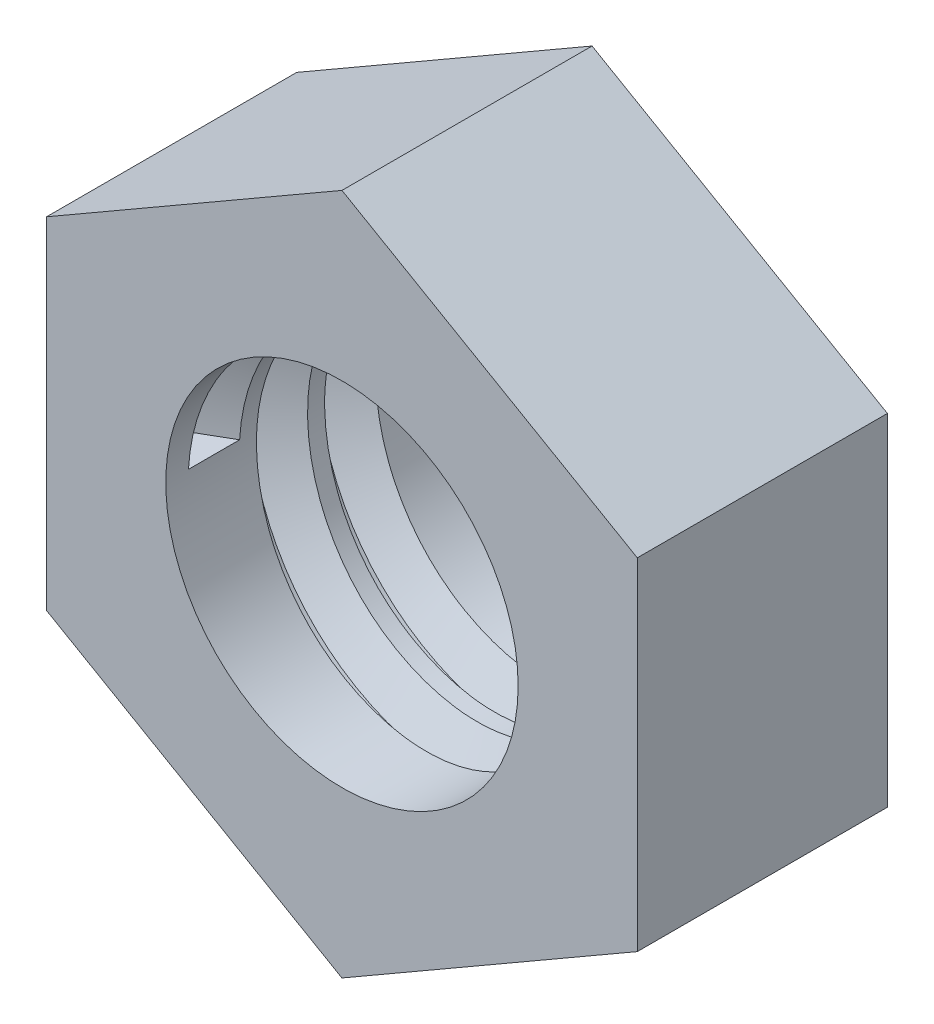
from build123d import *

# Parameters (mm, degrees)
SKETCH1_R           = 1.55
BOSS_EXTRUDE1_DEPTH = 2.2
THREAD1_PITCH       = 0.6


with BuildPart() as part:
    # Sketch1 → Boss-Extrude1 (new body)
    with BuildSketch(Plane.XY):
        Polygon((-2.598076211, -1.5), (0, -3), (2.598076211, -1.5), (2.598076211, 1.5), (0, 3), (-2.598076211, 1.5), align=None)
        Circle(SKETCH1_R, mode=Mode.SUBTRACT)
    extrude(amount=BOSS_EXTRUDE1_DEPTH)

    # Thread1: the profile of Thread Profile1 profile screwed along a right-hand helix of 2.5 turns, 6 arcs to a turn; built about Z, then put on its axis
    thread1_z = Axis((0, 0, 0), (0, 0, 1))
    thread1_corners = [(1.5497, 0, -0.000173205), (1.874759525, 0, 0.187499999), (1.874759525, 0, 0.262499999), (1.5497, 0, 0.450173203)]
    with BuildLine(mode=Mode.PRIVATE) as thread1_profile:
        Line(thread1_corners[0], thread1_corners[1])
        Line(thread1_corners[1], thread1_corners[2])
        Line(thread1_corners[2], thread1_corners[3])
        Line(thread1_corners[3], thread1_corners[0])
    thread1_cap = Face(thread1_profile.wire())
    thread1_turn_angles = [0, 30, 60, 90, 120, 150, 180, 210, 240, 270, 300, 330, 360]
    thread1_turn_weights = [1, 0.8660254037844387, 1, 0.8660254037844387, 1, 0.8660254037844387, 1, 0.8660254037844387, 1, 0.8660254037844387, 1, 0.8660254037844387, 1]
    thread1_turn_rails = [Edge.make_bspline([Vector(p[0], p[1], 0).rotate(thread1_z, thread1_turn_angles[k]) / thread1_turn_weights[k] + Vector(0, 0, p[2] + THREAD1_PITCH * thread1_turn_angles[k] / 360) for k in range(13)], [0, 0, 0, 1, 1, 2, 2, 3, 3, 4, 4, 5, 5, 6, 6, 6], 2, thread1_turn_weights) for p in thread1_corners]
    thread1_turn_sides = [Face.make_surface_from_curves(thread1_turn_rails[p[0]], thread1_turn_rails[p[1]]) for p in [(0, 1), (1, 2), (2, 3), (3, 0)]]
    thread1_last_angles = [720, 750, 780, 810, 840, 870, 900]
    thread1_last_weights = [1, 0.8660254037844387, 1, 0.8660254037844387, 1, 0.8660254037844387, 1]
    thread1_last_rails = [Edge.make_bspline([Vector(p[0], p[1], 0).rotate(thread1_z, thread1_last_angles[k]) / thread1_last_weights[k] + Vector(0, 0, p[2] + THREAD1_PITCH * thread1_last_angles[k] / 360) for k in range(7)], [0, 0, 0, 1, 1, 2, 2, 3, 3, 3], 2, thread1_last_weights) for p in thread1_corners]
    thread1_last_sides = [Face.make_surface_from_curves(thread1_last_rails[p[0]], thread1_last_rails[p[1]]) for p in [(0, 1), (1, 2), (2, 3), (3, 0)]]
    thread1 = Plane(origin=(0, 0, 2), x_dir=(-1, 0, 0), z_dir=(0, 0, -1)) * Solid(Shell([*[p.moved(Location((0, 0, THREAD1_PITCH * i))) for i in range(2) for p in thread1_turn_sides], *thread1_last_sides, thread1_cap, thread1_cap.rotate(thread1_z, 900).moved(Location((0, 0, THREAD1_PITCH * 900 / 360)))]))
    add(thread1, mode=Mode.SUBTRACT)


solid = part.part
